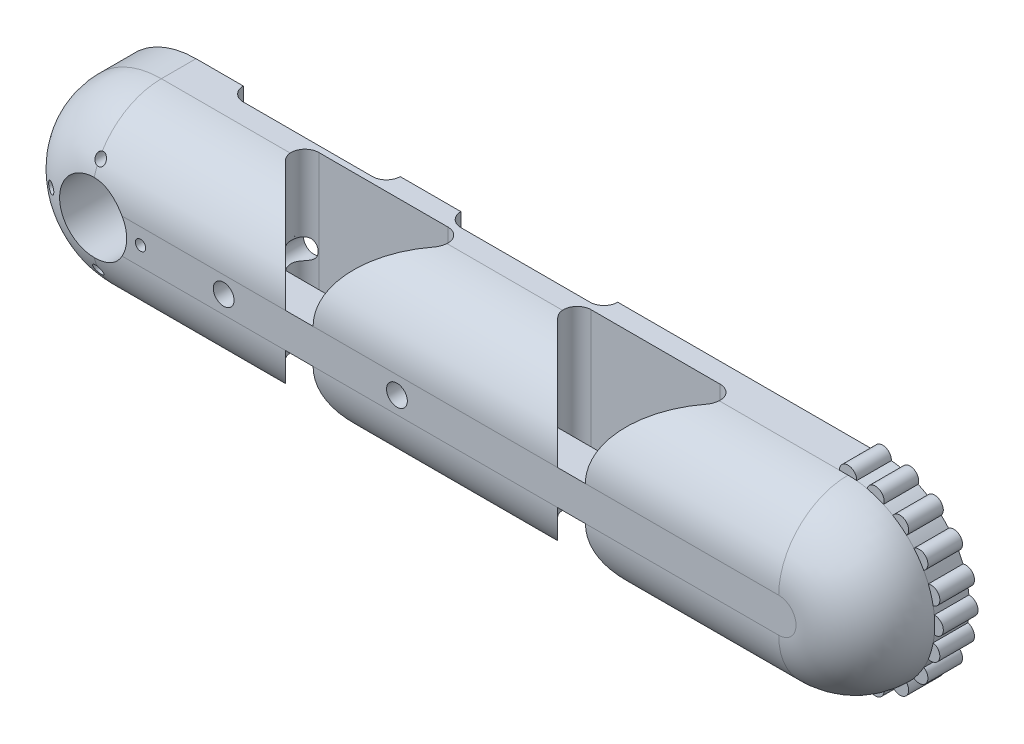
from build123d import *

# Parameters (mm, degrees)
SKIZZE1_R                       = 5
AUFSATZ_LINEAR_AUSTRAGEN1_DEPTH = 15
SKIZZE3_R                       = 10.45
SCHNITT_LINEAR_AUSTRAGEN2_DEPTH = 2
VERRUNDUNG2_R                   = 10
SCHNITT_LINEAR_AUSTRAGEN7_DEPTH = 37
SKIZZE10_R                      = 0.75
SCHNITT_LINEAR_AUSTRAGEN8_DEPTH = 37
SKIZZE11_R                      = 1.5
SCHNITT_LINEAR_AUSTRAGEN9_DEPTH = 37
AUFSATZ_LINEAR_AUSTRAGEN2_DEPTH = 5
SKIZZE13_R                      = 1.25
AUFSATZ_LINEAR_AUSTRAGEN3_DEPTH = 5
SKIZZE14_W                      = 33.480791396
SKIZZE14_H                      = 5
SKIZZE14_W_2                    = 17.826061528
AUFSATZ_LINEAR_AUSTRAGEN4_DEPTH = 5


with BuildPart() as part:
    # Skizze1 → Aufsatz-Linear austragen1 (new body)
    with BuildSketch(Plane.XY):
        with BuildLine():
            Line((15.182884174, 0), (114.248452833, 0))
            ThreePointArc((114.248452833, 0), (126.748452833, 12.5), (114.248452833, 25))
            Line((114.248452833, 25), (15.182884174, 25))
            ThreePointArc((15.182884174, 25), (2.682884174, 12.5), (15.182884174, 0))
        make_face()
        with Locations((15.182884174, 12.5)):
            Circle(SKIZZE1_R, mode=Mode.SUBTRACT)
    extrude(amount=AUFSATZ_LINEAR_AUSTRAGEN1_DEPTH)

    # Skizze3 → Schnitt-Linear austragen2 (cut)
    with BuildSketch(Plane(origin=(0, 0, 0), x_dir=(-1, 0, 0), z_dir=(0, 0, -1))):
        with Locations((-15.182884174, 12.5)):
            Circle(SKIZZE3_R)
    extrude(amount=-SCHNITT_LINEAR_AUSTRAGEN2_DEPTH, mode=Mode.SUBTRACT)

    # Verrundung2
    # the kernel refuses this fillet: 10 mm, written as the material it takes off along each edge
    with BuildSketch(Plane(origin=(114.248452833, 25, 15), x_dir=(0, -1, 0), z_dir=(-1, 0, 0))) as verrundung2_piece_1:
        with BuildLine():
            CenterArc((VERRUNDUNG2_R, -VERRUNDUNG2_R), VERRUNDUNG2_R, 90, 90)
            Line((0, -VERRUNDUNG2_R), (0, 0))
            Line((0, 0), (VERRUNDUNG2_R, 0))
        make_face()
    extrude(amount=99.065568659, mode=Mode.SUBTRACT)
    with BuildSketch(Plane(origin=(15.182884174, 0, 15), x_dir=(0, 0, -1), z_dir=(1, 0, 0))) as verrundung2_piece_2:
        with BuildLine():
            CenterArc((VERRUNDUNG2_R, VERRUNDUNG2_R), VERRUNDUNG2_R, 180, 90)
            Line((0, VERRUNDUNG2_R), (0, 0))
            Line((0, 0), (VERRUNDUNG2_R, 0))
        make_face()
    extrude(amount=99.065568659, mode=Mode.SUBTRACT)
    with BuildSketch(Plane(origin=(114.248452833, 12.5, 15), x_dir=(0, -1, 0), z_dir=(-1, 0, 0))) as verrundung2_piece_3:
        with BuildLine():
            CenterArc((12.5 - VERRUNDUNG2_R, -VERRUNDUNG2_R), VERRUNDUNG2_R, 0, 90)
            Line((12.5 - VERRUNDUNG2_R, 0), (12.5, 0))
            Line((12.5, 0), (12.5, -VERRUNDUNG2_R))
        make_face()
    revolve(axis=Axis((114.248452833, 12.5, 15), (0, 0, 1)), revolution_arc=180, mode=Mode.SUBTRACT)
    with BuildSketch(Plane(origin=(15.182884174, 12.5, 15), x_dir=(0, 1, 0), z_dir=(1, 0, 0))) as verrundung2_piece_4:
        with BuildLine():
            CenterArc((12.5 - VERRUNDUNG2_R, -VERRUNDUNG2_R), VERRUNDUNG2_R, 0, 90)
            Line((12.5 - VERRUNDUNG2_R, 0), (12.5, 0))
            Line((12.5, 0), (12.5, -VERRUNDUNG2_R))
        make_face()
    revolve(axis=Axis((15.182884174, 12.5, 15), (0, 0, 1)), revolution_arc=180, mode=Mode.SUBTRACT)

    # Skizze9 → Schnitt-Linear austragen7 (cut)
    with BuildSketch(Plane(origin=(0, 25, 0), x_dir=(1, 0, 0), z_dir=(0, 1, 0))):
        with BuildLine():
            Line((22.597097736, 1.414213562), (31.910806235, 10.727922061))
            ThreePointArc((31.910806235, 10.727922061), (33.325019798, 11.313708499), (34.73923336, 10.727922061))
            Line((34.73923336, 10.727922061), (44.052941859, 1.414213562))
            ThreePointArc((44.052941859, 1.414213562), (44.486487362, -0.765366865), (42.638728296, -2))
            Line((42.638728296, -2), (24.011311299, -2))
            ThreePointArc((24.011311299, -2), (22.163552234, -0.765366865), (22.597097736, 1.414213562))
        make_face()
        with BuildLine():
            Line((53.987746442, 1.414213562), (63.301454941, 10.727922061))
            ThreePointArc((63.301454941, 10.727922061), (64.715668503, 11.313708499), (66.129882066, 10.727922061))
            Line((66.129882066, 10.727922061), (75.443590565, 1.414213562))
            ThreePointArc((75.443590565, 1.414213562), (75.877136067, -0.765366865), (74.029377002, -2))
            Line((74.029377002, -2), (55.401960004, -2))
            ThreePointArc((55.401960004, -2), (53.554200939, -0.765366865), (53.987746442, 1.414213562))
        make_face()
        with BuildLine():
            Line((101.129942315, 1.414213562), (110.443650814, 10.727922061))
            ThreePointArc((110.443650814, 10.727922061), (111.857864376, 11.313708499), (113.272077939, 10.727922061))
            Line((113.272077939, 10.727922061), (122.585786438, 1.414213562))
            ThreePointArc((122.585786438, 1.414213562), (123.01933194, -0.765366865), (121.171572875, -2))
            Line((121.171572875, -2), (102.544155877, -2))
            ThreePointArc((102.544155877, -2), (100.696396812, -0.765366865), (101.129942315, 1.414213562))
        make_face()
        with BuildLine():
            Line((55.801454941, -6.274213562), (46.487746442, -15.587922061))
            ThreePointArc((46.487746442, -15.587922061), (45.07353288, -16.173708499), (43.659319317, -15.587922061))
            Line((43.659319317, -15.587922061), (34.345610818, -6.274213562))
            ThreePointArc((34.345610818, -6.274213562), (33.912065316, -4.094633135), (35.759824381, -2.86))
            Line((35.759824381, -2.86), (54.387241379, -2.86))
            ThreePointArc((54.387241379, -2.86), (56.235000444, -4.094633135), (55.801454941, -6.274213562))
        make_face()
        with BuildLine():
            Line((95.085726188, -6.274213562), (85.772017689, -15.587922061))
            ThreePointArc((85.772017689, -15.587922061), (84.357804127, -16.173708499), (82.943590565, -15.587922061))
            Line((82.943590565, -15.587922061), (73.629882066, -6.274213562))
            ThreePointArc((73.629882066, -6.274213562), (73.196336563, -4.094633135), (75.044095628, -2.86))
            Line((75.044095628, -2.86), (93.671512626, -2.86))
            ThreePointArc((93.671512626, -2.86), (95.519271691, -4.094633135), (95.085726188, -6.274213562))
        make_face()
    extrude(amount=-SCHNITT_LINEAR_AUSTRAGEN7_DEPTH, mode=Mode.SUBTRACT)

    # Skizze10 → Schnitt-Linear austragen8 (cut)
    with BuildSketch(Plane(origin=(0, 0, 2), x_dir=(-1, 0, 0), z_dir=(0, 0, -1))):
        with Locations((-15.350634314, 19.497989704)):
            Circle(SKIZZE10_R)
        with Locations((-14.994983776, 5.502522352)):
            Circle(SKIZZE10_R)
        with Locations((-8.184554244, 12.34710071)):
            Circle(SKIZZE10_R)
        with Locations((-22.180148024, 12.695700312)):
            Circle(SKIZZE10_R)
    extrude(amount=-SCHNITT_LINEAR_AUSTRAGEN8_DEPTH, mode=Mode.SUBTRACT)

    # Skizze11 → Schnitt-Linear austragen9 (cut)
    with BuildSketch(Plane.XY.offset(15)):
        with Locations((34.16945617, 12.560904018)):
            Circle(SKIZZE11_R)
        with Locations((59.169253905, 12.460339584)):
            Circle(SKIZZE11_R)
    extrude(amount=-SCHNITT_LINEAR_AUSTRAGEN9_DEPTH, mode=Mode.SUBTRACT)

    # Skizze12 → Aufsatz-Linear austragen2 (add)
    with BuildSketch(Plane(origin=(0, 0, 0), x_dir=(-1, 0, 0), z_dir=(0, 0, -1))):
        with BuildLine():
            Line((-114.248452833, 25), (-97.181505126, 25))
            Line((-97.181505126, 25), (-97.181505126, 0))
            Line((-97.181505126, 0), (-114.248452833, 0))
            ThreePointArc((-114.248452833, 0), (-126.748452833, 12.5), (-114.248452833, 25))
        make_face()
    extrude(amount=-AUFSATZ_LINEAR_AUSTRAGEN2_DEPTH)

    # Skizze13 → Aufsatz-Linear austragen3 (add)
    with BuildSketch(Plane(origin=(0, 0, 0), x_dir=(-1, 0, 0), z_dir=(0, 0, -1))):
        with Locations((-114.248452833, 0)):
            Circle(SKIZZE13_R)
        with Locations((-118.19692089, 0.64)):
            Circle(SKIZZE13_R)
        with Locations((-121.741065819, 2.494464)):
            Circle(SKIZZE13_R)
        with Locations((-124.517967177, 5.373494886)):
            Circle(SKIZZE13_R)
        with Locations((-126.243270267, 8.982279896)):
            Circle(SKIZZE13_R)
        with Locations((-126.748452833, 12.5)):
            Circle(SKIZZE13_R)
        with Locations((-126.243270267, 16.017720104)):
            Circle(SKIZZE13_R)
        with Locations((-124.517967177, 19.626505114)):
            Circle(SKIZZE13_R)
        with Locations((-114.248452833, 25)):
            Circle(SKIZZE13_R)
        with Locations((-121.741065819, 22.505536)):
            Circle(SKIZZE13_R)
        with Locations((-118.19692089, 24.36)):
            Circle(SKIZZE13_R)
    extrude(amount=-AUFSATZ_LINEAR_AUSTRAGEN3_DEPTH)

    # Skizze14 → Aufsatz-Linear austragen4 (add)
    with BuildSketch(Plane.XY.offset(15)):
        with Locations((84.429293691, 12.5)):
            Rectangle(SKIZZE14_W, SKIZZE14_H)
        with Locations((45.834913607, 12.5)):
            Rectangle(SKIZZE14_W_2, SKIZZE14_H)
    extrude(amount=-AUFSATZ_LINEAR_AUSTRAGEN4_DEPTH)


solid = part.part
